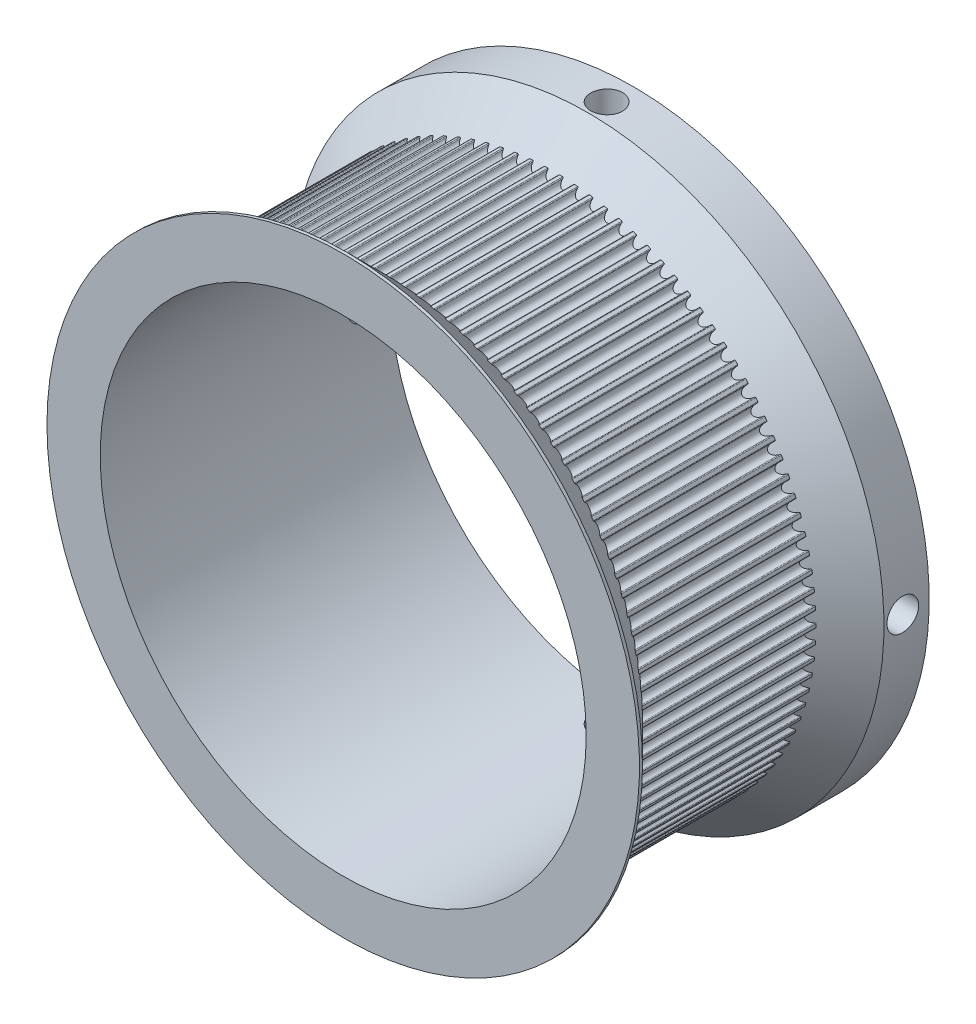
from build123d import *

# Parameters (mm, degrees)
BOSS_EXTRUDE1_DEPTH     = 12.5
CUT_EXTRUDE2_DEPTH      = 51.716404522
CUT_EXTRUDE2_DEPTH_BACK = 51.716404522
SKETCH4_R               = 32.2
BOSS_EXTRUDE2_START     = -38.4
SKETCH6_R               = 33.759502323
SKETCH6_R_2             = 32.2
BOSS_EXTRUDE2_DEPTH     = 38.4
CUT_EXTRUDE3_DEPTH      = 60.721160914
CUT_EXTRUDE3_DEPTH_BACK = 60.721160914
SKETCH7_R               = 2.1
CUT_EXTRUDE4_DEPTH      = 60.721160952
CUT_EXTRUDE4_DEPTH_BACK = 60.721160952
SKETCH8_R               = 2.1


with BuildPart() as part:
    # Sketch2 → Boss-Extrude1 (new, symmetric)
    with BuildSketch(Plane.XY):
        with BuildLine():
            ThreePointArc((-2.773591946, 34.649254961), (-2.695145424, 34.624730199), (-2.655594674, 34.552681195))
            ThreePointArc((-2.655594674, 34.552681195), (-1.941595452, 33.954620562), (-1.30042404, 34.630172655))
            ThreePointArc((-1.30042404, 34.630172655), (-1.26934406, 34.706260471), (-1.194204485, 34.739567604))
            ThreePointArc((-1.194204485, 34.739567604), (-0.992610824, 34.745912067), (-0.790983743, 34.751086693))
            ThreePointArc((-0.790983743, 34.751086693), (-0.714065248, 34.72212351), (-0.678692193, 34.647934105))
            ThreePointArc((-0.678692193, 34.647934105), (0, 34.01008748), (0.678692193, 34.647934105))
            ThreePointArc((0.678692193, 34.647934105), (0.714065248, 34.72212351), (0.790983743, 34.751086693))
            ThreePointArc((0.790983743, 34.751086693), (0.992610824, 34.745912067), (1.194204485, 34.739567604))
            ThreePointArc((1.194204485, 34.739567604), (1.26934406, 34.706260471), (1.30042404, 34.630172655))
            ThreePointArc((1.30042404, 34.630172655), (1.941595452, 33.954620562), (2.655594674, 34.552681195))
            ThreePointArc((2.655594674, 34.552681195), (2.695145424, 34.624730199), (2.773591946, 34.649254961))
            ThreePointArc((2.773591946, 34.649254961), (2.974594781, 34.632578124), (3.175497466, 34.614735265))
            ThreePointArc((3.175497466, 34.614735265), (3.248613031, 34.577192824), (3.275298561, 34.499454781))
            ThreePointArc((3.275298561, 34.499454781), (3.876857822, 33.788400729), (4.623835156, 34.344724621))
            ThreePointArc((4.623835156, 34.344724621), (4.667434595, 34.414398215), (4.747153269, 34.434404561))
            ThreePointArc((4.747153269, 34.434404561), (4.946876228, 34.40627991), (5.146432634, 34.376996855))
            ThreePointArc((5.146432634, 34.376996855), (5.217285702, 34.335341561), (5.239489738, 34.256206855))
            ThreePointArc((5.239489738, 34.256206855), (5.799474689, 33.511970156), (6.57699365, 34.024742694))
            ThreePointArc((6.57699365, 34.024742694), (6.624499565, 34.091813617), (6.705230364, 34.107236291))
            ThreePointArc((6.705230364, 34.107236291), (6.903021993, 34.067755561), (7.100581209, 34.027127827))
            ThreePointArc((7.100581209, 34.027127827), (7.168940672, 33.98149555), (7.186590789, 33.901222303))
            ThreePointArc((7.186590789, 33.901222303), (7.703174874, 33.126230502), (8.508699357, 33.593779128))
            ThreePointArc((8.508699357, 33.593779128), (8.559956794, 33.65802861), (8.641436392, 33.668817305))
            ThreePointArc((8.641436392, 33.668817305), (8.836651536, 33.618109276), (9.031569164, 33.56626938))
            ThreePointArc((9.031569164, 33.56626938), (9.097212047, 33.516808965), (9.110250674, 33.435659011))
            ThreePointArc((9.110250674, 33.435659011), (9.581748904, 32.632439969), (10.412651455, 33.053239637))
            ThreePointArc((10.412651455, 33.053239637), (10.467493224, 33.114458108), (10.549455851, 33.120577635))
            ThreePointArc((10.549455851, 33.120577635), (10.741457757, 33.058807705), (10.933098017, 32.995924739))
            ThreePointArc((10.933098017, 32.995924739), (10.995810207, 32.942797515), (11.004194815, 32.861035548))
            ThreePointArc((11.004194815, 32.861035548), (11.429069261, 32.0322092), (12.282639649, 32.404887349))
            ThreePointArc((12.282639649, 32.404887349), (12.340886866, 32.462875128), (12.423065177, 32.464305525))
            ThreePointArc((12.423065177, 32.464305525), (12.611227576, 32.391675175), (12.798965377, 32.31795425))
            ThreePointArc((12.798965377, 32.31795425), (12.85854232, 32.261333506), (12.86224556, 32.179226218))
            ThreePointArc((12.86224556, 32.179226218), (13.239110369, 31.327496023), (14.112564425, 31.650837053))
            ThreePointArc((14.112564425, 31.650837053), (14.1740271, 31.705404996), (14.256153046, 31.702141599))
            ThreePointArc((14.256153046, 31.702141599), (14.439862193, 31.618887733), (14.623085172, 31.534569312))
            ThreePointArc((14.623085172, 31.534569312), (14.679332541, 31.474639734), (14.678342334, 31.39245494))
            ThreePointArc((14.678342334, 31.39245494), (15.005968251, 30.520599064), (15.896456949, 30.793548306))
            ThreePointArc((15.896456949, 30.793548306), (15.960934604, 30.844518423), (16.042740308, 30.836571876))
            ThreePointArc((16.042740308, 30.836571876), (16.221396979, 30.742966052), (16.399507503, 30.648325163))
            ThreePointArc((16.399507503, 30.648325163), (16.45224183, 30.585282228), (16.446561406, 30.503287999))
            ThreePointArc((16.446561406, 30.503287999), (16.723879784, 29.614150256), (17.628498535, 29.835817405))
            ThreePointArc((17.628498535, 29.835817405), (17.695780857, 29.883023442), (17.776999485, 29.870419664))
            ThreePointArc((17.776999485, 29.870419664), (17.950020941, 29.766767205), (18.122438049, 29.662112548))
            ThreePointArc((18.122438049, 29.662112548), (18.171487325, 29.596161889), (18.161135212, 29.514625673))
            ThreePointArc((18.161135212, 29.514625673), (18.387241497, 28.611106245), (19.303039623, 28.780768269))
            ThreePointArc((19.303039623, 28.780768269), (19.372907151, 28.82405625), (19.453273785, 28.806836353))
            ThreePointArc((19.453273785, 28.806836353), (19.620095665, 28.693475351), (19.786256969, 28.579148287))
            ThreePointArc((19.786256969, 28.579148287), (19.831461206, 28.510505022), (19.816471171, 28.429692773))
            ThreePointArc((19.816471171, 28.429692773), (19.99062785, 27.514738752), (20.914618207, 27.631842249))
            ThreePointArc((20.914618207, 27.631842249), (20.986843048, 27.671070978), (21.06609555, 27.649291129))
            ThreePointArc((21.06609555, 27.649291129), (21.226173716, 27.526591344), (21.385537231, 27.402964784))
            ThreePointArc((21.385537231, 27.402964784), (21.426748983, 27.331852814), (21.40716992, 27.252028124))
            ThreePointArc((21.40716992, 27.252028124), (21.52880893, 26.3286239), (22.457977655, 26.392786903))
            ThreePointArc((22.457977655, 26.392786903), (22.532324226, 26.427828424), (22.610204089, 26.401559664))
            ThreePointArc((22.610204089, 26.401559664), (22.763016399, 26.269921318), (22.915062316, 26.137398506))
            ThreePointArc((22.915062316, 26.137398506), (22.952147158, 26.064049782), (22.928042929, 25.985473023))
            ThreePointArc((22.928042929, 25.985473023), (22.99676751, 25.056630549), (23.928083847, 25.067643772))
            ThreePointArc((23.928083847, 25.067643772), (24.004309645, 25.098383786), (24.080562842, 25.067711799))
            ThreePointArc((24.080562842, 25.067711799), (24.225610855, 24.927564268), (24.369843231, 24.786577467))
            ThreePointArc((24.369843231, 24.786577467), (24.4026802, 24.711231238), (24.374129429, 24.634158711))
            ThreePointArc((24.374129429, 24.634158711), (24.389715415, 23.702907678), (25.320141603, 23.660735197))
            ThreePointArc((25.320141603, 23.660735197), (25.397997996, 23.687073437), (25.472375804, 23.652098269))
            ThreePointArc((25.472375804, 23.652098269), (25.609186403, 23.503898685), (25.745134782, 23.354907764))
            ThreePointArc((25.745134782, 23.354907764), (25.773616771, 23.277809793), (25.740712584, 23.202492894))
            ThreePointArc((25.740712584, 23.202492894), (25.703109137, 22.271870849), (26.62961032, 22.176650222))
            ThreePointArc((26.62961032, 22.176650222), (26.708843356, 22.198500778), (26.781103171, 22.15933651))
            ThreePointArc((26.781103171, 22.15933651), (26.909230108, 22.00356827), (27.036451055, 21.847059207))
            ThreePointArc((27.036451055, 21.847059207), (27.060485161, 21.768460971), (27.023334886, 21.695145367))
            ThreePointArc((27.023334886, 21.695145367), (26.93266466, 20.768187806), (27.852218783, 20.620229623))
            ThreePointArc((27.852218783, 20.620229623), (27.93257002, 20.637521224), (28.002476146, 20.594295602))
            ThreePointArc((28.002476146, 20.594295602), (28.121501497, 20.431466789), (28.239580044, 20.267950083))
            ThreePointArc((28.239580044, 20.267950083), (28.259087873, 20.188107955), (28.217812685, 20.117032785))
            ThreePointArc((28.217812685, 20.117032785), (28.074371428, 19.196763251), (28.983979097, 18.996550121))
            ThreePointArc((28.983979097, 18.996550121), (29.065186447, 19.009226365), (29.132510864, 18.962080381))
            ThreePointArc((29.132510864, 18.962080381), (29.242046394, 18.79272211), (29.350597393, 18.622731119))
            ThreePointArc((29.350597393, 18.622731119), (29.365515314, 18.541905526), (29.320249845, 18.473302624))
            ThreePointArc((29.320249845, 18.473302624), (29.124505432, 17.562722845), (30.021199697, 17.310907821))
            ThreePointArc((30.021199697, 17.310907821), (30.102998277, 17.31892736), (30.167521387, 17.268014796))
            ThreePointArc((30.167521387, 17.268014796), (30.267209814, 17.092679478), (30.365879193, 16.916768676))
            ThreePointArc((30.365879193, 16.916768676), (30.376158548, 16.835223255), (30.327050444, 16.76931639))
            ThreePointArc((30.327050444, 16.76931639), (30.079641354, 15.871396487), (30.960497382, 15.568800938))
            ThreePointArc((30.960497382, 15.568800938), (31.042620384, 15.572137615), (31.104131725, 15.517624536))
            ThreePointArc((31.104131725, 15.517624536), (31.193647886, 15.336884077), (31.282113808, 15.155627251))
            ThreePointArc((31.282113808, 15.155627251), (31.287721067, 15.073627986), (31.234930509, 15.01063213))
            ThreePointArc((31.234930509, 15.01063213), (30.936663737, 14.128300933), (31.798808361, 13.775911863))
            ThreePointArc((31.798808361, 13.775911863), (31.880987915, 13.774554793), (31.939286851, 13.71661901))
            ThreePointArc((31.939286851, 13.71661901), (32.018338762, 13.531062949), (32.096312669, 13.345051319))
            ThreePointArc((32.096312669, 13.345051319), (32.097229542, 13.262865675), (32.040928722, 13.202986309))
            ThreePointArc((32.040928722, 13.202986309), (31.692777153, 12.339121797), (32.533398236, 11.938088626))
            ThreePointArc((32.533398236, 11.938088626), (32.615366291, 11.932042236), (32.670262662, 11.870872724))
            ThreePointArc((32.670262662, 11.870872724), (32.738592473, 11.681106306), (32.805820029, 11.490946604))
            ThreePointArc((32.805820029, 11.490946604), (32.802043527, 11.408842653), (32.742416085, 11.352275091))
            ThreePointArc((32.742416085, 11.352275091), (32.345515318, 10.509695012), (33.161870928, 10.061325826))
            ThreePointArc((33.161870928, 10.061325826), (33.24336012, 10.050609838), (33.294674867, 9.986406118))
            ThreePointArc((33.294674867, 9.986406118), (33.352059699, 9.793048322), (33.408321623, 9.59936081))
            ThreePointArc((33.408321623, 9.59936081), (33.399864063, 9.517606357), (33.337104493, 9.464535111))
            ThreePointArc((33.337104493, 9.464535111), (32.892749135, 8.645987785), (33.68217649, 8.151745072))
            ThreePointArc((33.68217649, 8.151745072), (33.762921019, 8.136394439), (33.810486762, 8.069365931))
            ThreePointArc((33.810486762, 8.069365931), (33.85673944, 7.87304745), (33.901852216, 7.676463895))
            ThreePointArc((33.901852216, 7.676463895), (33.888741185, 7.595325608), (33.823054195, 7.545923785))
            ThreePointArc((33.823054195, 7.545923785), (33.332693641, 6.754079143), (34.092617793, 6.215575019))
            ThreePointArc((34.092617793, 6.215575019), (34.172354287, 6.195639813), (34.216015878, 6.12600515))
            ThreePointArc((34.216015878, 6.12600515), (34.250985533, 5.927366333), (34.284802014, 5.728527951))
            ThreePointArc((34.284802014, 5.728527951), (34.267080277, 5.648270485), (34.198680124, 5.602699224))
            ThreePointArc((34.198680124, 5.602699224), (33.663913828, 4.840140099), (34.391856064, 4.259131053))
            ThreePointArc((34.391856064, 4.259131053), (34.470324438, 4.234676298), (34.509939461, 4.162662614))
            ThreePointArc((34.509939461, 4.162662614), (34.533512031, 3.96235138), (34.555921914, 3.76190674))
            ThreePointArc((34.555921914, 3.76190674), (34.533647276, 3.682791878), (34.462757067, 3.641199822))
            ThreePointArc((34.462757067, 3.641199822), (33.885329326, 2.910413524), (34.578915248, 2.288794687))
            ThreePointArc((34.578915248, 2.288794687), (34.655859555, 2.259900149), (34.691298795, 2.185742337))
            ThreePointArc((34.691298795, 2.185742337), (34.70339739, 1.98441206), (34.714327579, 1.783014971))
            ThreePointArc((34.714327579, 1.783014971), (34.687572695, 1.70530077), (34.61442366, 1.667823584))
            ThreePointArc((34.61442366, 1.667823584), (33.996217923, 0.971193786), (34.653185198, 0.310992749))
            ThreePointArc((34.653185198, 0.310992749), (34.728354462, 0.277752675), (34.759502323, 0.201692623))
            ThreePointArc((34.759502323, 0.201692623), (34.76008748, 0), (34.759502323, -0.201692623))
            ThreePointArc((34.759502323, -0.201692623), (34.728354462, -0.277752675), (34.653185198, -0.310992749))
            ThreePointArc((34.653185198, -0.310992749), (33.996217923, -0.971193786), (34.61442366, -1.667823584))
            ThreePointArc((34.61442366, -1.667823584), (34.687572695, -1.70530077), (34.714327579, -1.783014971))
            ThreePointArc((34.714327579, -1.783014971), (34.70339739, -1.98441206), (34.691298795, -2.185742337))
            ThreePointArc((34.691298795, -2.185742337), (34.655859555, -2.259900149), (34.578915248, -2.288794687))
            ThreePointArc((34.578915248, -2.288794687), (33.885329326, -2.910413524), (34.462757067, -3.641199822))
            ThreePointArc((34.462757067, -3.641199822), (34.533647276, -3.682791878), (34.555921914, -3.76190674))
            ThreePointArc((34.555921914, -3.76190674), (34.533512031, -3.96235138), (34.509939461, -4.162662614))
            ThreePointArc((34.509939461, -4.162662614), (34.470324438, -4.234676298), (34.391856064, -4.259131053))
            ThreePointArc((34.391856064, -4.259131053), (33.663913828, -4.840140099), (34.198680124, -5.602699224))
            ThreePointArc((34.198680124, -5.602699224), (34.267080277, -5.648270485), (34.284802014, -5.728527951))
            ThreePointArc((34.284802014, -5.728527951), (34.250985533, -5.927366333), (34.216015878, -6.12600515))
            ThreePointArc((34.216015878, -6.12600515), (34.172354287, -6.195639813), (34.092617793, -6.215575019))
            ThreePointArc((34.092617793, -6.215575019), (33.332693641, -6.754079143), (33.823054195, -7.545923785))
            ThreePointArc((33.823054195, -7.545923785), (33.888741185, -7.595325608), (33.901852216, -7.676463895))
            ThreePointArc((33.901852216, -7.676463895), (33.85673944, -7.87304745), (33.810486762, -8.069365931))
            ThreePointArc((33.810486762, -8.069365931), (33.762921019, -8.136394439), (33.68217649, -8.151745072))
            ThreePointArc((33.68217649, -8.151745072), (32.892749135, -8.645987785), (33.337104493, -9.464535111))
            ThreePointArc((33.337104493, -9.464535111), (33.399864063, -9.517606357), (33.408321623, -9.59936081))
            ThreePointArc((33.408321623, -9.59936081), (33.352059699, -9.793048322), (33.294674867, -9.986406118))
            ThreePointArc((33.294674867, -9.986406118), (33.24336012, -10.050609838), (33.161870928, -10.061325826))
            ThreePointArc((33.161870928, -10.061325826), (32.345515318, -10.509695012), (32.742416085, -11.352275091))
            ThreePointArc((32.742416085, -11.352275091), (32.802043527, -11.408842653), (32.805820029, -11.490946604))
            ThreePointArc((32.805820029, -11.490946604), (32.738592473, -11.681106306), (32.670262662, -11.870872724))
            ThreePointArc((32.670262662, -11.870872724), (32.615366291, -11.932042236), (32.533398236, -11.938088626))
            ThreePointArc((32.533398236, -11.938088626), (31.692777153, -12.339121797), (32.040928722, -13.202986309))
            ThreePointArc((32.040928722, -13.202986309), (32.097229542, -13.262865675), (32.096312669, -13.345051319))
            ThreePointArc((32.096312669, -13.345051319), (32.018338762, -13.531062949), (31.939286851, -13.71661901))
            ThreePointArc((31.939286851, -13.71661901), (31.880987915, -13.774554793), (31.798808361, -13.775911863))
            ThreePointArc((31.798808361, -13.775911863), (30.936663737, -14.128300933), (31.234930509, -15.01063213))
            ThreePointArc((31.234930509, -15.01063213), (31.287721067, -15.073627986), (31.282113808, -15.155627251))
            ThreePointArc((31.282113808, -15.155627251), (31.193647886, -15.336884077), (31.104131725, -15.517624536))
            ThreePointArc((31.104131725, -15.517624536), (31.042620384, -15.572137615), (30.960497382, -15.568800938))
            ThreePointArc((30.960497382, -15.568800938), (30.079641354, -15.871396487), (30.327050444, -16.76931639))
            ThreePointArc((30.327050444, -16.76931639), (30.376158548, -16.835223255), (30.365879193, -16.916768676))
            ThreePointArc((30.365879193, -16.916768676), (30.267209814, -17.092679478), (30.167521387, -17.268014796))
            ThreePointArc((30.167521387, -17.268014796), (30.102998277, -17.31892736), (30.021199697, -17.310907821))
            ThreePointArc((30.021199697, -17.310907821), (29.124505432, -17.562722845), (29.320249845, -18.473302624))
            ThreePointArc((29.320249845, -18.473302624), (29.365515314, -18.541905526), (29.350597393, -18.622731119))
            ThreePointArc((29.350597393, -18.622731119), (29.242046394, -18.79272211), (29.132510864, -18.962080381))
            ThreePointArc((29.132510864, -18.962080381), (29.065186447, -19.009226365), (28.983979097, -18.996550121))
            ThreePointArc((28.983979097, -18.996550121), (28.074371428, -19.196763251), (28.217812685, -20.117032785))
            ThreePointArc((28.217812685, -20.117032785), (28.259087873, -20.188107955), (28.239580044, -20.267950083))
            ThreePointArc((28.239580044, -20.267950083), (28.121501497, -20.431466789), (28.002476146, -20.594295602))
            ThreePointArc((28.002476146, -20.594295602), (27.93257002, -20.637521224), (27.852218783, -20.620229623))
            ThreePointArc((27.852218783, -20.620229623), (26.93266466, -20.768187806), (27.023334886, -21.695145367))
            ThreePointArc((27.023334886, -21.695145367), (27.060485161, -21.768460971), (27.036451055, -21.847059207))
            ThreePointArc((27.036451055, -21.847059207), (26.909230108, -22.00356827), (26.781103171, -22.15933651))
            ThreePointArc((26.781103171, -22.15933651), (26.708843356, -22.198500778), (26.62961032, -22.176650222))
            ThreePointArc((26.62961032, -22.176650222), (25.703109137, -22.271870849), (25.740712584, -23.202492894))
            ThreePointArc((25.740712584, -23.202492894), (25.773616771, -23.277809793), (25.745134782, -23.354907764))
            ThreePointArc((25.745134782, -23.354907764), (25.609186403, -23.503898685), (25.472375804, -23.652098269))
            ThreePointArc((25.472375804, -23.652098269), (25.397997996, -23.687073437), (25.320141603, -23.660735197))
            ThreePointArc((25.320141603, -23.660735197), (24.389715415, -23.702907678), (24.374129429, -24.634158711))
            ThreePointArc((24.374129429, -24.634158711), (24.4026802, -24.711231238), (24.369843231, -24.786577467))
            ThreePointArc((24.369843231, -24.786577467), (24.225610855, -24.927564268), (24.080562842, -25.067711799))
            ThreePointArc((24.080562842, -25.067711799), (24.004309645, -25.098383786), (23.928083847, -25.067643772))
            ThreePointArc((23.928083847, -25.067643772), (22.99676751, -25.056630549), (22.928042929, -25.985473023))
            ThreePointArc((22.928042929, -25.985473023), (22.952147158, -26.064049782), (22.915062316, -26.137398506))
            ThreePointArc((22.915062316, -26.137398506), (22.763016399, -26.269921318), (22.610204089, -26.401559664))
            ThreePointArc((22.610204089, -26.401559664), (22.532324226, -26.427828424), (22.457977655, -26.392786903))
            ThreePointArc((22.457977655, -26.392786903), (21.52880893, -26.3286239), (21.40716992, -27.252028124))
            ThreePointArc((21.40716992, -27.252028124), (21.426748983, -27.331852814), (21.385537231, -27.402964784))
            ThreePointArc((21.385537231, -27.402964784), (21.226173716, -27.526591344), (21.06609555, -27.649291129))
            ThreePointArc((21.06609555, -27.649291129), (20.986843048, -27.671070978), (20.914618207, -27.631842249))
            ThreePointArc((20.914618207, -27.631842249), (19.99062785, -27.514738752), (19.816471171, -28.429692773))
            ThreePointArc((19.816471171, -28.429692773), (19.831461206, -28.510505022), (19.786256969, -28.579148287))
            ThreePointArc((19.786256969, -28.579148287), (19.620095665, -28.693475351), (19.453273785, -28.806836353))
            ThreePointArc((19.453273785, -28.806836353), (19.372907151, -28.82405625), (19.303039623, -28.780768269))
            ThreePointArc((19.303039623, -28.780768269), (18.387241497, -28.611106245), (18.161135212, -29.514625673))
            ThreePointArc((18.161135212, -29.514625673), (18.171487325, -29.596161889), (18.122438049, -29.662112548))
            ThreePointArc((18.122438049, -29.662112548), (17.950020941, -29.766767205), (17.776999485, -29.870419664))
            ThreePointArc((17.776999485, -29.870419664), (17.695780857, -29.883023442), (17.628498535, -29.835817405))
            ThreePointArc((17.628498535, -29.835817405), (16.723879784, -29.614150256), (16.446561406, -30.503287999))
            ThreePointArc((16.446561406, -30.503287999), (16.45224183, -30.585282228), (16.399507503, -30.648325163))
            ThreePointArc((16.399507503, -30.648325163), (16.221396979, -30.742966052), (16.042740308, -30.836571876))
            ThreePointArc((16.042740308, -30.836571876), (15.960934604, -30.844518423), (15.896456949, -30.793548306))
            ThreePointArc((15.896456949, -30.793548306), (15.005968251, -30.520599064), (14.678342334, -31.39245494))
            ThreePointArc((14.678342334, -31.39245494), (14.679332541, -31.474639734), (14.623085172, -31.534569312))
            ThreePointArc((14.623085172, -31.534569312), (14.439862193, -31.618887733), (14.256153046, -31.702141599))
            ThreePointArc((14.256153046, -31.702141599), (14.1740271, -31.705404996), (14.112564425, -31.650837053))
            ThreePointArc((14.112564425, -31.650837053), (13.239110369, -31.327496023), (12.86224556, -32.179226218))
            ThreePointArc((12.86224556, -32.179226218), (12.85854232, -32.261333506), (12.798965377, -32.31795425))
            ThreePointArc((12.798965377, -32.31795425), (12.611227576, -32.391675175), (12.423065177, -32.464305525))
            ThreePointArc((12.423065177, -32.464305525), (12.340886866, -32.462875128), (12.282639649, -32.404887349))
            ThreePointArc((12.282639649, -32.404887349), (11.429069261, -32.0322092), (11.004194815, -32.861035548))
            ThreePointArc((11.004194815, -32.861035548), (10.995810207, -32.942797515), (10.933098017, -32.995924739))
            ThreePointArc((10.933098017, -32.995924739), (10.741457757, -33.058807705), (10.549455851, -33.120577635))
            ThreePointArc((10.549455851, -33.120577635), (10.467493224, -33.114458108), (10.412651455, -33.053239637))
            ThreePointArc((10.412651455, -33.053239637), (9.581748904, -32.632439969), (9.110250674, -33.435659011))
            ThreePointArc((9.110250674, -33.435659011), (9.097212047, -33.516808965), (9.031569164, -33.56626938))
            ThreePointArc((9.031569164, -33.56626938), (8.836651536, -33.618109276), (8.641436392, -33.668817305))
            ThreePointArc((8.641436392, -33.668817305), (8.559956794, -33.65802861), (8.508699357, -33.593779128))
            ThreePointArc((8.508699357, -33.593779128), (7.703174874, -33.126230502), (7.186590789, -33.901222303))
            ThreePointArc((7.186590789, -33.901222303), (7.168940672, -33.98149555), (7.100581209, -34.027127827))
            ThreePointArc((7.100581209, -34.027127827), (6.903021993, -34.067755561), (6.705230364, -34.107236291))
            ThreePointArc((6.705230364, -34.107236291), (6.624499565, -34.091813617), (6.57699365, -34.024742694))
            ThreePointArc((6.57699365, -34.024742694), (5.799474689, -33.511970156), (5.239489738, -34.256206855))
            ThreePointArc((5.239489738, -34.256206855), (5.217285702, -34.335341561), (5.146432634, -34.376996855))
            ThreePointArc((5.146432634, -34.376996855), (4.946876228, -34.40627991), (4.747153269, -34.434404561))
            ThreePointArc((4.747153269, -34.434404561), (4.667434595, -34.414398215), (4.623835156, -34.344724621))
            ThreePointArc((4.623835156, -34.344724621), (3.876857822, -33.788400729), (3.275298561, -34.499454781))
            ThreePointArc((3.275298561, -34.499454781), (3.248613031, -34.577192824), (3.175497466, -34.614735265))
            ThreePointArc((3.175497466, -34.614735265), (2.974594781, -34.632578124), (2.773591946, -34.649254961))
            ThreePointArc((2.773591946, -34.649254961), (2.695145424, -34.624730199), (2.655594674, -34.552681195))
            ThreePointArc((2.655594674, -34.552681195), (1.941595452, -33.954620562), (1.30042404, -34.630172655))
            ThreePointArc((1.30042404, -34.630172655), (1.26934406, -34.706260471), (1.194204485, -34.739567604))
            ThreePointArc((1.194204485, -34.739567604), (0.992610824, -34.745912067), (0.790983743, -34.751086693))
            ThreePointArc((0.790983743, -34.751086693), (0.714065248, -34.72212351), (0.678692193, -34.647934105))
            ThreePointArc((0.678692193, -34.647934105), (0, -34.01008748), (-0.678692193, -34.647934105))
            ThreePointArc((-0.678692193, -34.647934105), (-0.714065248, -34.72212351), (-0.790983743, -34.751086693))
            ThreePointArc((-0.790983743, -34.751086693), (-0.992610824, -34.745912067), (-1.194204485, -34.739567604))
            ThreePointArc((-1.194204485, -34.739567604), (-1.26934406, -34.706260471), (-1.30042404, -34.630172655))
            ThreePointArc((-1.30042404, -34.630172655), (-1.941595452, -33.954620562), (-2.655594674, -34.552681195))
            ThreePointArc((-2.655594674, -34.552681195), (-2.695145424, -34.624730199), (-2.773591946, -34.649254961))
            ThreePointArc((-2.773591946, -34.649254961), (-2.974594781, -34.632578124), (-3.175497466, -34.614735265))
            ThreePointArc((-3.175497466, -34.614735265), (-3.248613031, -34.577192824), (-3.275298561, -34.499454781))
            ThreePointArc((-3.275298561, -34.499454781), (-3.876857822, -33.788400729), (-4.623835156, -34.344724621))
            ThreePointArc((-4.623835156, -34.344724621), (-4.667434595, -34.414398215), (-4.747153269, -34.434404561))
            ThreePointArc((-4.747153269, -34.434404561), (-4.946876228, -34.40627991), (-5.146432634, -34.376996855))
            ThreePointArc((-5.146432634, -34.376996855), (-5.217285702, -34.335341561), (-5.239489738, -34.256206855))
            ThreePointArc((-5.239489738, -34.256206855), (-5.799474689, -33.511970156), (-6.57699365, -34.024742694))
            ThreePointArc((-6.57699365, -34.024742694), (-6.624499565, -34.091813617), (-6.705230364, -34.107236291))
            ThreePointArc((-6.705230364, -34.107236291), (-6.903021993, -34.067755561), (-7.100581209, -34.027127827))
            ThreePointArc((-7.100581209, -34.027127827), (-7.168940672, -33.98149555), (-7.186590789, -33.901222303))
            ThreePointArc((-7.186590789, -33.901222303), (-7.703174874, -33.126230502), (-8.508699357, -33.593779128))
            ThreePointArc((-8.508699357, -33.593779128), (-8.559956794, -33.65802861), (-8.641436392, -33.668817305))
            ThreePointArc((-8.641436392, -33.668817305), (-8.836651536, -33.618109276), (-9.031569164, -33.56626938))
            ThreePointArc((-9.031569164, -33.56626938), (-9.097212047, -33.516808965), (-9.110250674, -33.435659011))
            ThreePointArc((-9.110250674, -33.435659011), (-9.581748904, -32.632439969), (-10.412651455, -33.053239637))
            ThreePointArc((-10.412651455, -33.053239637), (-10.467493224, -33.114458108), (-10.549455851, -33.120577635))
            ThreePointArc((-10.549455851, -33.120577635), (-10.741457757, -33.058807705), (-10.933098017, -32.995924739))
            ThreePointArc((-10.933098017, -32.995924739), (-10.995810207, -32.942797515), (-11.004194815, -32.861035548))
            ThreePointArc((-11.004194815, -32.861035548), (-11.429069261, -32.0322092), (-12.282639649, -32.404887349))
            ThreePointArc((-12.282639649, -32.404887349), (-12.340886866, -32.462875128), (-12.423065177, -32.464305525))
            ThreePointArc((-12.423065177, -32.464305525), (-12.611227576, -32.391675175), (-12.798965377, -32.31795425))
            ThreePointArc((-12.798965377, -32.31795425), (-12.85854232, -32.261333506), (-12.86224556, -32.179226218))
            ThreePointArc((-12.86224556, -32.179226218), (-13.239110369, -31.327496023), (-14.112564425, -31.650837053))
            ThreePointArc((-14.112564425, -31.650837053), (-14.1740271, -31.705404996), (-14.256153046, -31.702141599))
            ThreePointArc((-14.256153046, -31.702141599), (-14.439862193, -31.618887733), (-14.623085172, -31.534569312))
            ThreePointArc((-14.623085172, -31.534569312), (-14.679332541, -31.474639734), (-14.678342334, -31.39245494))
            ThreePointArc((-14.678342334, -31.39245494), (-15.005968251, -30.520599064), (-15.896456949, -30.793548306))
            ThreePointArc((-15.896456949, -30.793548306), (-15.960934604, -30.844518423), (-16.042740308, -30.836571876))
            ThreePointArc((-16.042740308, -30.836571876), (-16.221396979, -30.742966052), (-16.399507503, -30.648325163))
            ThreePointArc((-16.399507503, -30.648325163), (-16.45224183, -30.585282228), (-16.446561406, -30.503287999))
            ThreePointArc((-16.446561406, -30.503287999), (-16.723879784, -29.614150256), (-17.628498535, -29.835817405))
            ThreePointArc((-17.628498535, -29.835817405), (-17.695780857, -29.883023442), (-17.776999485, -29.870419664))
            ThreePointArc((-17.776999485, -29.870419664), (-17.950020941, -29.766767205), (-18.122438049, -29.662112548))
            ThreePointArc((-18.122438049, -29.662112548), (-18.171487325, -29.596161889), (-18.161135212, -29.514625673))
            ThreePointArc((-18.161135212, -29.514625673), (-18.387241497, -28.611106245), (-19.303039623, -28.780768269))
            ThreePointArc((-19.303039623, -28.780768269), (-19.372907151, -28.82405625), (-19.453273785, -28.806836353))
            ThreePointArc((-19.453273785, -28.806836353), (-19.620095665, -28.693475351), (-19.786256969, -28.579148287))
            ThreePointArc((-19.786256969, -28.579148287), (-19.831461206, -28.510505022), (-19.816471171, -28.429692773))
            ThreePointArc((-19.816471171, -28.429692773), (-19.99062785, -27.514738752), (-20.914618207, -27.631842249))
            ThreePointArc((-20.914618207, -27.631842249), (-20.986843048, -27.671070978), (-21.06609555, -27.649291129))
            ThreePointArc((-21.06609555, -27.649291129), (-21.226173716, -27.526591344), (-21.385537231, -27.402964784))
            ThreePointArc((-21.385537231, -27.402964784), (-21.426748983, -27.331852814), (-21.40716992, -27.252028124))
            ThreePointArc((-21.40716992, -27.252028124), (-21.52880893, -26.3286239), (-22.457977655, -26.392786903))
            ThreePointArc((-22.457977655, -26.392786903), (-22.532324226, -26.427828424), (-22.610204089, -26.401559664))
            ThreePointArc((-22.610204089, -26.401559664), (-22.763016399, -26.269921318), (-22.915062316, -26.137398506))
            ThreePointArc((-22.915062316, -26.137398506), (-22.952147158, -26.064049782), (-22.928042929, -25.985473023))
            ThreePointArc((-22.928042929, -25.985473023), (-22.99676751, -25.056630549), (-23.928083847, -25.067643772))
            ThreePointArc((-23.928083847, -25.067643772), (-24.004309645, -25.098383786), (-24.080562842, -25.067711799))
            ThreePointArc((-24.080562842, -25.067711799), (-24.225610855, -24.927564268), (-24.369843231, -24.786577467))
            ThreePointArc((-24.369843231, -24.786577467), (-24.4026802, -24.711231238), (-24.374129429, -24.634158711))
            ThreePointArc((-24.374129429, -24.634158711), (-24.389715415, -23.702907678), (-25.320141603, -23.660735197))
            ThreePointArc((-25.320141603, -23.660735197), (-25.397997996, -23.687073437), (-25.472375804, -23.652098269))
            ThreePointArc((-25.472375804, -23.652098269), (-25.609186403, -23.503898685), (-25.745134782, -23.354907764))
            ThreePointArc((-25.745134782, -23.354907764), (-25.773616771, -23.277809793), (-25.740712584, -23.202492894))
            ThreePointArc((-25.740712584, -23.202492894), (-25.703109137, -22.271870849), (-26.62961032, -22.176650222))
            ThreePointArc((-26.62961032, -22.176650222), (-26.708843356, -22.198500778), (-26.781103171, -22.15933651))
            ThreePointArc((-26.781103171, -22.15933651), (-26.909230108, -22.00356827), (-27.036451055, -21.847059207))
            ThreePointArc((-27.036451055, -21.847059207), (-27.060485161, -21.768460971), (-27.023334886, -21.695145367))
            ThreePointArc((-27.023334886, -21.695145367), (-26.93266466, -20.768187806), (-27.852218783, -20.620229623))
            ThreePointArc((-27.852218783, -20.620229623), (-27.93257002, -20.637521224), (-28.002476146, -20.594295602))
            ThreePointArc((-28.002476146, -20.594295602), (-28.121501497, -20.431466789), (-28.239580044, -20.267950083))
            ThreePointArc((-28.239580044, -20.267950083), (-28.259087873, -20.188107955), (-28.217812685, -20.117032785))
            ThreePointArc((-28.217812685, -20.117032785), (-28.074371428, -19.196763251), (-28.983979097, -18.996550121))
            ThreePointArc((-28.983979097, -18.996550121), (-29.065186447, -19.009226365), (-29.132510864, -18.962080381))
            ThreePointArc((-29.132510864, -18.962080381), (-29.242046394, -18.79272211), (-29.350597393, -18.622731119))
            ThreePointArc((-29.350597393, -18.622731119), (-29.365515314, -18.541905526), (-29.320249845, -18.473302624))
            ThreePointArc((-29.320249845, -18.473302624), (-29.124505432, -17.562722845), (-30.021199697, -17.310907821))
            ThreePointArc((-30.021199697, -17.310907821), (-30.102998277, -17.31892736), (-30.167521387, -17.268014796))
            ThreePointArc((-30.167521387, -17.268014796), (-30.267209814, -17.092679478), (-30.365879193, -16.916768676))
            ThreePointArc((-30.365879193, -16.916768676), (-30.376158548, -16.835223255), (-30.327050444, -16.76931639))
            ThreePointArc((-30.327050444, -16.76931639), (-30.079641354, -15.871396487), (-30.960497382, -15.568800938))
            ThreePointArc((-30.960497382, -15.568800938), (-31.042620384, -15.572137615), (-31.104131725, -15.517624536))
            ThreePointArc((-31.104131725, -15.517624536), (-31.193647886, -15.336884077), (-31.282113808, -15.155627251))
            ThreePointArc((-31.282113808, -15.155627251), (-31.287721067, -15.073627986), (-31.234930509, -15.01063213))
            ThreePointArc((-31.234930509, -15.01063213), (-30.936663737, -14.128300933), (-31.798808361, -13.775911863))
            ThreePointArc((-31.798808361, -13.775911863), (-31.880987915, -13.774554793), (-31.939286851, -13.71661901))
            ThreePointArc((-31.939286851, -13.71661901), (-32.018338762, -13.531062949), (-32.096312669, -13.345051319))
            ThreePointArc((-32.096312669, -13.345051319), (-32.097229542, -13.262865675), (-32.040928722, -13.202986309))
            ThreePointArc((-32.040928722, -13.202986309), (-31.692777153, -12.339121797), (-32.533398236, -11.938088626))
            ThreePointArc((-32.533398236, -11.938088626), (-32.615366291, -11.932042236), (-32.670262662, -11.870872724))
            ThreePointArc((-32.670262662, -11.870872724), (-32.738592473, -11.681106306), (-32.805820029, -11.490946604))
            ThreePointArc((-32.805820029, -11.490946604), (-32.802043527, -11.408842653), (-32.742416085, -11.352275091))
            ThreePointArc((-32.742416085, -11.352275091), (-32.345515318, -10.509695012), (-33.161870928, -10.061325826))
            ThreePointArc((-33.161870928, -10.061325826), (-33.24336012, -10.050609838), (-33.294674867, -9.986406118))
            ThreePointArc((-33.294674867, -9.986406118), (-33.352059699, -9.793048322), (-33.408321623, -9.59936081))
            ThreePointArc((-33.408321623, -9.59936081), (-33.399864063, -9.517606357), (-33.337104493, -9.464535111))
            ThreePointArc((-33.337104493, -9.464535111), (-32.892749135, -8.645987785), (-33.68217649, -8.151745072))
            ThreePointArc((-33.68217649, -8.151745072), (-33.762921019, -8.136394439), (-33.810486762, -8.069365931))
            ThreePointArc((-33.810486762, -8.069365931), (-33.85673944, -7.87304745), (-33.901852216, -7.676463895))
            ThreePointArc((-33.901852216, -7.676463895), (-33.888741185, -7.595325608), (-33.823054195, -7.545923785))
            ThreePointArc((-33.823054195, -7.545923785), (-33.332693641, -6.754079143), (-34.092617793, -6.215575019))
            ThreePointArc((-34.092617793, -6.215575019), (-34.172354287, -6.195639813), (-34.216015878, -6.12600515))
            ThreePointArc((-34.216015878, -6.12600515), (-34.250985533, -5.927366333), (-34.284802014, -5.728527951))
            ThreePointArc((-34.284802014, -5.728527951), (-34.267080277, -5.648270485), (-34.198680124, -5.602699224))
            ThreePointArc((-34.198680124, -5.602699224), (-33.663913828, -4.840140099), (-34.391856064, -4.259131053))
            ThreePointArc((-34.391856064, -4.259131053), (-34.470324438, -4.234676298), (-34.509939461, -4.162662614))
            ThreePointArc((-34.509939461, -4.162662614), (-34.533512031, -3.96235138), (-34.555921914, -3.76190674))
            ThreePointArc((-34.555921914, -3.76190674), (-34.533647276, -3.682791878), (-34.462757067, -3.641199822))
            ThreePointArc((-34.462757067, -3.641199822), (-33.885329326, -2.910413524), (-34.578915248, -2.288794687))
            ThreePointArc((-34.578915248, -2.288794687), (-34.655859555, -2.259900149), (-34.691298795, -2.185742337))
            ThreePointArc((-34.691298795, -2.185742337), (-34.70339739, -1.98441206), (-34.714327579, -1.783014971))
            ThreePointArc((-34.714327579, -1.783014971), (-34.687572695, -1.70530077), (-34.61442366, -1.667823584))
            ThreePointArc((-34.61442366, -1.667823584), (-33.996217923, -0.971193786), (-34.653185198, -0.310992749))
            ThreePointArc((-34.653185198, -0.310992749), (-34.728354462, -0.277752675), (-34.759502323, -0.201692623))
            ThreePointArc((-34.759502323, -0.201692623), (-34.76008748, 0), (-34.759502323, 0.201692623))
            ThreePointArc((-34.759502323, 0.201692623), (-34.728354462, 0.277752675), (-34.653185198, 0.310992749))
            ThreePointArc((-34.653185198, 0.310992749), (-33.996217923, 0.971193786), (-34.61442366, 1.667823584))
            ThreePointArc((-34.61442366, 1.667823584), (-34.687572695, 1.70530077), (-34.714327579, 1.783014971))
            ThreePointArc((-34.714327579, 1.783014971), (-34.70339739, 1.98441206), (-34.691298795, 2.185742337))
            ThreePointArc((-34.691298795, 2.185742337), (-34.655859555, 2.259900149), (-34.578915248, 2.288794687))
            ThreePointArc((-34.578915248, 2.288794687), (-33.885329326, 2.910413524), (-34.462757067, 3.641199822))
            ThreePointArc((-34.462757067, 3.641199822), (-34.533647276, 3.682791878), (-34.555921914, 3.76190674))
            ThreePointArc((-34.555921914, 3.76190674), (-34.533512031, 3.96235138), (-34.509939461, 4.162662614))
            ThreePointArc((-34.509939461, 4.162662614), (-34.470324438, 4.234676298), (-34.391856064, 4.259131053))
            ThreePointArc((-34.391856064, 4.259131053), (-33.663913828, 4.840140099), (-34.198680124, 5.602699224))
            ThreePointArc((-34.198680124, 5.602699224), (-34.267080277, 5.648270485), (-34.284802014, 5.728527951))
            ThreePointArc((-34.284802014, 5.728527951), (-34.250985533, 5.927366333), (-34.216015878, 6.12600515))
            ThreePointArc((-34.216015878, 6.12600515), (-34.172354287, 6.195639813), (-34.092617793, 6.215575019))
            ThreePointArc((-34.092617793, 6.215575019), (-33.332693641, 6.754079143), (-33.823054195, 7.545923785))
            ThreePointArc((-33.823054195, 7.545923785), (-33.888741185, 7.595325608), (-33.901852216, 7.676463895))
            ThreePointArc((-33.901852216, 7.676463895), (-33.85673944, 7.87304745), (-33.810486762, 8.069365931))
            ThreePointArc((-33.810486762, 8.069365931), (-33.762921019, 8.136394439), (-33.68217649, 8.151745072))
            ThreePointArc((-33.68217649, 8.151745072), (-32.892749135, 8.645987785), (-33.337104493, 9.464535111))
            ThreePointArc((-33.337104493, 9.464535111), (-33.399864063, 9.517606357), (-33.408321623, 9.59936081))
            ThreePointArc((-33.408321623, 9.59936081), (-33.352059699, 9.793048322), (-33.294674867, 9.986406118))
            ThreePointArc((-33.294674867, 9.986406118), (-33.24336012, 10.050609838), (-33.161870928, 10.061325826))
            ThreePointArc((-33.161870928, 10.061325826), (-32.345515318, 10.509695012), (-32.742416085, 11.352275091))
            ThreePointArc((-32.742416085, 11.352275091), (-32.802043527, 11.408842653), (-32.805820029, 11.490946604))
            ThreePointArc((-32.805820029, 11.490946604), (-32.738592473, 11.681106306), (-32.670262662, 11.870872724))
            ThreePointArc((-32.670262662, 11.870872724), (-32.615366291, 11.932042236), (-32.533398236, 11.938088626))
            ThreePointArc((-32.533398236, 11.938088626), (-31.692777153, 12.339121797), (-32.040928722, 13.202986309))
            ThreePointArc((-32.040928722, 13.202986309), (-32.097229542, 13.262865675), (-32.096312669, 13.345051319))
            ThreePointArc((-32.096312669, 13.345051319), (-32.018338762, 13.531062949), (-31.939286851, 13.71661901))
            ThreePointArc((-31.939286851, 13.71661901), (-31.880987915, 13.774554793), (-31.798808361, 13.775911863))
            ThreePointArc((-31.798808361, 13.775911863), (-30.936663737, 14.128300933), (-31.234930509, 15.01063213))
            ThreePointArc((-31.234930509, 15.01063213), (-31.287721067, 15.073627986), (-31.282113808, 15.155627251))
            ThreePointArc((-31.282113808, 15.155627251), (-31.193647886, 15.336884077), (-31.104131725, 15.517624536))
            ThreePointArc((-31.104131725, 15.517624536), (-31.042620384, 15.572137615), (-30.960497382, 15.568800938))
            ThreePointArc((-30.960497382, 15.568800938), (-30.079641354, 15.871396487), (-30.327050444, 16.76931639))
            ThreePointArc((-30.327050444, 16.76931639), (-30.376158548, 16.835223255), (-30.365879193, 16.916768676))
            ThreePointArc((-30.365879193, 16.916768676), (-30.267209814, 17.092679478), (-30.167521387, 17.268014796))
            ThreePointArc((-30.167521387, 17.268014796), (-30.102998277, 17.31892736), (-30.021199697, 17.310907821))
            ThreePointArc((-30.021199697, 17.310907821), (-29.124505432, 17.562722845), (-29.320249845, 18.473302624))
            ThreePointArc((-29.320249845, 18.473302624), (-29.365515314, 18.541905526), (-29.350597393, 18.622731119))
            ThreePointArc((-29.350597393, 18.622731119), (-29.242046394, 18.79272211), (-29.132510864, 18.962080381))
            ThreePointArc((-29.132510864, 18.962080381), (-29.065186447, 19.009226365), (-28.983979097, 18.996550121))
            ThreePointArc((-28.983979097, 18.996550121), (-28.074371428, 19.196763251), (-28.217812685, 20.117032785))
            ThreePointArc((-28.217812685, 20.117032785), (-28.259087873, 20.188107955), (-28.239580044, 20.267950083))
            ThreePointArc((-28.239580044, 20.267950083), (-28.121501497, 20.431466789), (-28.002476146, 20.594295602))
            ThreePointArc((-28.002476146, 20.594295602), (-27.93257002, 20.637521224), (-27.852218783, 20.620229623))
            ThreePointArc((-27.852218783, 20.620229623), (-26.93266466, 20.768187806), (-27.023334886, 21.695145367))
            ThreePointArc((-27.023334886, 21.695145367), (-27.060485161, 21.768460971), (-27.036451055, 21.847059207))
            ThreePointArc((-27.036451055, 21.847059207), (-26.909230108, 22.00356827), (-26.781103171, 22.15933651))
            ThreePointArc((-26.781103171, 22.15933651), (-26.708843356, 22.198500778), (-26.62961032, 22.176650222))
            ThreePointArc((-26.62961032, 22.176650222), (-25.703109137, 22.271870849), (-25.740712584, 23.202492894))
            ThreePointArc((-25.740712584, 23.202492894), (-25.773616771, 23.277809793), (-25.745134782, 23.354907764))
            ThreePointArc((-25.745134782, 23.354907764), (-25.609186403, 23.503898685), (-25.472375804, 23.652098269))
            ThreePointArc((-25.472375804, 23.652098269), (-25.397997996, 23.687073437), (-25.320141603, 23.660735197))
            ThreePointArc((-25.320141603, 23.660735197), (-24.389715415, 23.702907678), (-24.374129429, 24.634158711))
            ThreePointArc((-24.374129429, 24.634158711), (-24.4026802, 24.711231238), (-24.369843231, 24.786577467))
            ThreePointArc((-24.369843231, 24.786577467), (-24.225610855, 24.927564268), (-24.080562842, 25.067711799))
            ThreePointArc((-24.080562842, 25.067711799), (-24.004309645, 25.098383786), (-23.928083847, 25.067643772))
            ThreePointArc((-23.928083847, 25.067643772), (-22.99676751, 25.056630549), (-22.928042929, 25.985473023))
            ThreePointArc((-22.928042929, 25.985473023), (-22.952147158, 26.064049782), (-22.915062316, 26.137398506))
            ThreePointArc((-22.915062316, 26.137398506), (-22.763016399, 26.269921318), (-22.610204089, 26.401559664))
            ThreePointArc((-22.610204089, 26.401559664), (-22.532324226, 26.427828424), (-22.457977655, 26.392786903))
            ThreePointArc((-22.457977655, 26.392786903), (-21.52880893, 26.3286239), (-21.40716992, 27.252028124))
            ThreePointArc((-21.40716992, 27.252028124), (-21.426748983, 27.331852814), (-21.385537231, 27.402964784))
            ThreePointArc((-21.385537231, 27.402964784), (-21.226173716, 27.526591344), (-21.06609555, 27.649291129))
            ThreePointArc((-21.06609555, 27.649291129), (-20.986843048, 27.671070978), (-20.914618207, 27.631842249))
            ThreePointArc((-20.914618207, 27.631842249), (-19.99062785, 27.514738752), (-19.816471171, 28.429692773))
            ThreePointArc((-19.816471171, 28.429692773), (-19.831461206, 28.510505022), (-19.786256969, 28.579148287))
            ThreePointArc((-19.786256969, 28.579148287), (-19.620095665, 28.693475351), (-19.453273785, 28.806836353))
            ThreePointArc((-19.453273785, 28.806836353), (-19.372907151, 28.82405625), (-19.303039623, 28.780768269))
            ThreePointArc((-19.303039623, 28.780768269), (-18.387241497, 28.611106245), (-18.161135212, 29.514625673))
            ThreePointArc((-18.161135212, 29.514625673), (-18.171487325, 29.596161889), (-18.122438049, 29.662112548))
            ThreePointArc((-18.122438049, 29.662112548), (-17.950020941, 29.766767205), (-17.776999485, 29.870419664))
            ThreePointArc((-17.776999485, 29.870419664), (-17.695780857, 29.883023442), (-17.628498535, 29.835817405))
            ThreePointArc((-17.628498535, 29.835817405), (-16.723879784, 29.614150256), (-16.446561406, 30.503287999))
            ThreePointArc((-16.446561406, 30.503287999), (-16.45224183, 30.585282228), (-16.399507503, 30.648325163))
            ThreePointArc((-16.399507503, 30.648325163), (-16.221396979, 30.742966052), (-16.042740308, 30.836571876))
            ThreePointArc((-16.042740308, 30.836571876), (-15.960934604, 30.844518423), (-15.896456949, 30.793548306))
            ThreePointArc((-15.896456949, 30.793548306), (-15.005968251, 30.520599064), (-14.678342334, 31.39245494))
            ThreePointArc((-14.678342334, 31.39245494), (-14.679332541, 31.474639734), (-14.623085172, 31.534569312))
            ThreePointArc((-14.623085172, 31.534569312), (-14.439862193, 31.618887733), (-14.256153046, 31.702141599))
            ThreePointArc((-14.256153046, 31.702141599), (-14.1740271, 31.705404996), (-14.112564425, 31.650837053))
            ThreePointArc((-14.112564425, 31.650837053), (-13.239110369, 31.327496023), (-12.86224556, 32.179226218))
            ThreePointArc((-12.86224556, 32.179226218), (-12.85854232, 32.261333506), (-12.798965377, 32.31795425))
            ThreePointArc((-12.798965377, 32.31795425), (-12.611227576, 32.391675175), (-12.423065177, 32.464305525))
            ThreePointArc((-12.423065177, 32.464305525), (-12.340886866, 32.462875128), (-12.282639649, 32.404887349))
            ThreePointArc((-12.282639649, 32.404887349), (-11.429069261, 32.0322092), (-11.004194815, 32.861035548))
            ThreePointArc((-11.004194815, 32.861035548), (-10.995810207, 32.942797515), (-10.933098017, 32.995924739))
            ThreePointArc((-10.933098017, 32.995924739), (-10.741457757, 33.058807705), (-10.549455851, 33.120577635))
            ThreePointArc((-10.549455851, 33.120577635), (-10.467493224, 33.114458108), (-10.412651455, 33.053239637))
            ThreePointArc((-10.412651455, 33.053239637), (-9.581748904, 32.632439969), (-9.110250674, 33.435659011))
            ThreePointArc((-9.110250674, 33.435659011), (-9.097212047, 33.516808965), (-9.031569164, 33.56626938))
            ThreePointArc((-9.031569164, 33.56626938), (-8.836651536, 33.618109276), (-8.641436392, 33.668817305))
            ThreePointArc((-8.641436392, 33.668817305), (-8.559956794, 33.65802861), (-8.508699357, 33.593779128))
            ThreePointArc((-8.508699357, 33.593779128), (-7.703174874, 33.126230502), (-7.186590789, 33.901222303))
            ThreePointArc((-7.186590789, 33.901222303), (-7.168940672, 33.98149555), (-7.100581209, 34.027127827))
            ThreePointArc((-7.100581209, 34.027127827), (-6.903021993, 34.067755561), (-6.705230364, 34.107236291))
            ThreePointArc((-6.705230364, 34.107236291), (-6.624499565, 34.091813617), (-6.57699365, 34.024742694))
            ThreePointArc((-6.57699365, 34.024742694), (-5.799474689, 33.511970156), (-5.239489738, 34.256206855))
            ThreePointArc((-5.239489738, 34.256206855), (-5.217285702, 34.335341561), (-5.146432634, 34.376996855))
            ThreePointArc((-5.146432634, 34.376996855), (-4.946876228, 34.40627991), (-4.747153269, 34.434404561))
            ThreePointArc((-4.747153269, 34.434404561), (-4.667434595, 34.414398215), (-4.623835156, 34.344724621))
            ThreePointArc((-4.623835156, 34.344724621), (-3.876857822, 33.788400729), (-3.275298561, 34.499454781))
            ThreePointArc((-3.275298561, 34.499454781), (-3.248613031, 34.577192824), (-3.175497466, 34.614735265))
            ThreePointArc((-3.175497466, 34.614735265), (-2.974594781, 34.632578124), (-2.773591946, 34.649254961))
        make_face()
    extrude(amount=BOSS_EXTRUDE1_DEPTH, both=True)

    # Sketch4 → Cut-Extrude2 (cut, two sides: drawn at the far end of the back side and taken through both)
    with BuildSketch(Plane.XY.offset(-CUT_EXTRUDE2_DEPTH_BACK)):
        Circle(SKETCH4_R)
    extrude(amount=CUT_EXTRUDE2_DEPTH + CUT_EXTRUDE2_DEPTH_BACK, mode=Mode.SUBTRACT)

    # Sketch5 → Revolve1 (revolve)
    with BuildSketch(Plane(origin=(0, 0, 0), x_dir=(1, 0, 0), z_dir=(0, 1, 0))):
        Polygon((-39.259502323, 22), (-39.259502323, 16), (-33.759502323, 10.5), (-33.759502323, 22), align=None)
        Polygon((-33.759502323, -10.5), (-39.259502323, -16), (-39.259502323, -16.4), (-33.759502323, -16.4), align=None)
    revolve(axis=Axis((0, 0, -25.99417387), (0, 0, 1)))

    # Sketch6 → Boss-Extrude2 (add)
    with BuildSketch(Plane.XY.offset(16.4).offset(BOSS_EXTRUDE2_START)):
        Circle(SKETCH6_R)
        Circle(SKETCH6_R_2, mode=Mode.SUBTRACT)
    extrude(amount=BOSS_EXTRUDE2_DEPTH)

    # Sketch7 → Cut-Extrude3 (cut, two sides: drawn at the far end of the back side and taken through both)
    with BuildSketch(Plane(origin=(0, 0, 0), x_dir=(1, 0, 0), z_dir=(0, 1, 0)).offset(-CUT_EXTRUDE3_DEPTH_BACK)):
        with Locations(Location((0, 18.5, 0), (0, 0, 270))):
            Circle(SKETCH7_R)
    extrude(amount=CUT_EXTRUDE3_DEPTH + CUT_EXTRUDE3_DEPTH_BACK, mode=Mode.SUBTRACT)

    # Sketch8 → Cut-Extrude4 (cut, two sides: drawn at the far end of the back side and taken through both)
    with BuildSketch(Plane(origin=(0, 0, 0), x_dir=(0, 0, -1), z_dir=(1, 0, 0)).offset(-CUT_EXTRUDE4_DEPTH_BACK)):
        with Locations((18.5, 0)):
            Circle(SKETCH8_R)
    extrude(amount=CUT_EXTRUDE4_DEPTH + CUT_EXTRUDE4_DEPTH_BACK, mode=Mode.SUBTRACT)


solid = part.part
